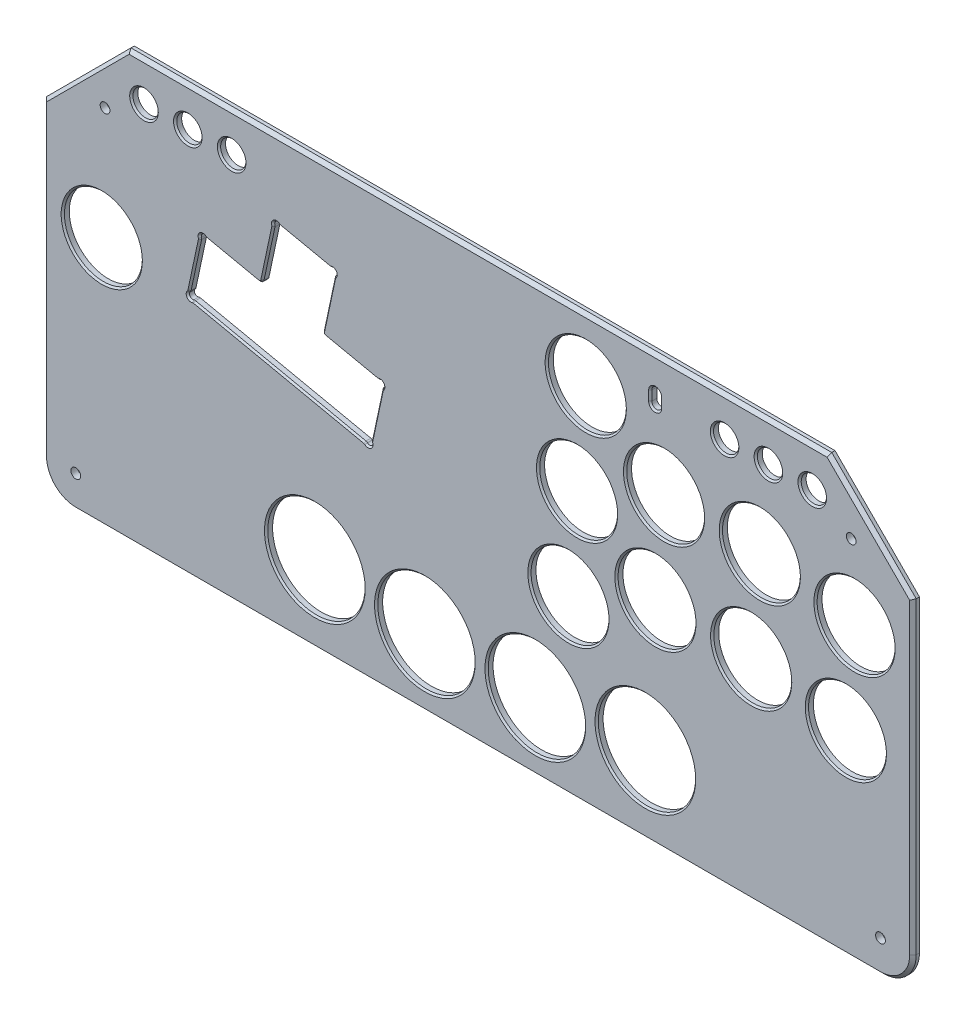
from build123d import *

# Parameters (mm, degrees)
BOSS_EXTRUDE1_DEPTH   = 2
SKETCH24_R            = 3.9
CUT_EXTRUDE2_DEPTH    = 307.159370556
SKETCH1_R             = 12
SKETCH1_R_2           = 15
CUT_EXTRUDE3_DEPTH    = 307.159370556
CUT_EXTRUDE5_DEPTH    = 326.796729683
CUT_EXTRUDE6_DEPTH    = 307.159370556
F_3_0MM_DOWEL_HOLE1_D = 3
FILLET1_R             = 1
CHAMFER1_SIZE         = 1
CHAMFER2_SIZE         = 0.5


with BuildPart() as part:
    # Sketch2 → Boss-Extrude1 (new body)
    with BuildSketch(Plane.XY):
        with BuildLine():
            Line((6.41186441, 110.238694526), (6.41186441, 15.286374556))
            ThreePointArc((6.41186441, 15.286374556), (9.340796598, 8.215306744), (16.41186441, 5.286374556))
            Line((16.41186441, 5.286374556), (264.168886442, 5.286374556))
            ThreePointArc((264.168886442, 5.286374556), (271.239954254, 8.215306744), (274.168886442, 15.286374556))
            Line((274.168886442, 15.286374556), (274.168886442, 110.238694526))
            Line((274.168886442, 110.238694526), (248.168886442, 136.238694526))
            Line((248.168886442, 136.238694526), (32.41186441, 136.238694526))
            Line((32.41186441, 136.238694526), (6.41186441, 110.238694526))
        make_face()
    extrude(amount=-BOSS_EXTRUDE1_DEPTH)

    # Sketch24 → Cut-Extrude2 (cut, through all)
    with BuildSketch(Plane.XY):
        with Locations((37.41186441, 124.238694526)):
            Circle(SKETCH24_R)
        with Locations((50.91186441, 124.238694526)):
            Circle(SKETCH24_R)
        with Locations((64.41186441, 124.238694526)):
            Circle(SKETCH24_R)
        with Locations((216.168886442, 124.238694526)):
            Circle(SKETCH24_R)
        with Locations((229.668886442, 124.238694526)):
            Circle(SKETCH24_R)
        with Locations((243.168886442, 124.238694526)):
            Circle(SKETCH24_R)
        with BuildLine():
            Line((193.298949614, 125.738694526), (193.298949614, 122.738694526))
            ThreePointArc((193.298949614, 122.738694526), (194.798949614, 121.238694526), (196.298949614, 122.738694526))
            Line((196.298949614, 122.738694526), (196.298949614, 125.738694526))
            ThreePointArc((196.298949614, 125.738694526), (194.798949614, 127.238694526), (193.298949614, 125.738694526))
        make_face()
    extrude(amount=-CUT_EXTRUDE2_DEPTH, mode=Mode.SUBTRACT)

    # Sketch1 → Cut-Extrude3 (cut, through all)
    with BuildSketch(Plane.XY):
        with Locations((24.41186441, 82.179064133)):
            Circle(SKETCH1_R)
        with Locations((168.091946024, 58.360067852)):
            Circle(SKETCH1_R)
        with Locations((194.873540874, 70.729230202)):
            Circle(SKETCH1_R)
        with Locations((224.358659158, 69.792320505)):
            Circle(SKETCH1_R)
        with Locations((253.510608286, 65.274150291)):
            Circle(SKETCH1_R)
        with Locations((256.168886442, 94.654135948)):
            Circle(SKETCH1_R)
        with Locations((227.016937315, 99.172306162)):
            Circle(SKETCH1_R)
        with Locations((197.531819031, 100.10921586)):
            Circle(SKETCH1_R)
        with Locations((170.75022418, 87.740053509)):
            Circle(SKETCH1_R)
        with Locations((191.774681199, 29.091460603)):
            Circle(SKETCH1_R_2)
        with Locations((157.891946024, 26.270067852)):
            Circle(SKETCH1_R_2)
        with Locations((123.891946024, 26.270067852)):
            Circle(SKETCH1_R_2)
        with Locations((90.009210849, 29.091460603)):
            Circle(SKETCH1_R_2)
        with Locations((173.429012786, 117.118176179)):
            Circle(SKETCH1_R)
    extrude(amount=-CUT_EXTRUDE3_DEPTH, mode=Mode.SUBTRACT)

    # Sketch4 → Cut-Extrude5 (cut, through all)
    with BuildSketch(Plane(origin=(-30.20834345, 20.07496957, 0), x_dir=(0.9781476007338056, -0.2079116908177598, 0), z_dir=(0, 0, 1))):
        Polygon((86.170570415, 113.241725336), (86.170570415, 94.191725336), (67.120570415, 94.191725336), (67.120570415, 75.141725336), (124.270570415, 75.141725336), (124.270570415, 94.191725336), (105.220570415, 94.191725336), (105.220570415, 113.241725336), align=None)
    extrude(amount=-CUT_EXTRUDE5_DEPTH, mode=Mode.SUBTRACT)

    # Sketch27 → Cut-Extrude6 (cut, through all)
    with BuildSketch(Plane.XY):
        with BuildLine():
            Line((54.735010804, 96.86991883), (56.41235194, 97.9591969))
            ThreePointArc((56.41235194, 97.9591969), (55.029042337, 98.253228433), (54.735010804, 96.86991883))
        make_face()
        with BuildLine():
            Line((51.36235616, 81.002826242), (52.45163423, 79.325485106))
            ThreePointArc((52.45163423, 79.325485106), (51.068324627, 79.619516639), (51.36235616, 81.002826242))
        make_face()
        with BuildLine():
            Line((105.586150406, 68.031395041), (107.263491542, 69.120673111))
            ThreePointArc((107.263491542, 69.120673111), (106.969460009, 67.737363508), (105.586150406, 68.031395041))
        make_face()
        with BuildLine():
            Line((109.546868116, 86.665106835), (110.636146186, 84.987765699))
            ThreePointArc((110.636146186, 84.987765699), (110.930177719, 86.371075302), (109.546868116, 86.665106835))
        make_face()
        with BuildLine():
            Line((77.329440308, 111.542912914), (79.006781444, 112.632190984))
            ThreePointArc((79.006781444, 112.632190984), (77.623471841, 112.926222516), (77.329440308, 111.542912914))
        make_face()
        with BuildLine():
            Line((94.873874032, 109.259536339), (95.963152102, 107.582195203))
            ThreePointArc((95.963152102, 107.582195203), (96.257183635, 108.965504806), (94.873874032, 109.259536339))
        make_face()
    extrude(amount=-CUT_EXTRUDE6_DEPTH, mode=Mode.SUBTRACT)

    # Ø3.0mm Dowel Hole1 (through all)
    with Locations(Plane.XY):
        with Locations((25.42227205, 117.228286886), (16.41186441, 15.286374556), (264.168886442, 15.286374556), (255.158478802, 117.228286886)):
            Hole(F_3_0MM_DOWEL_HOLE1_D / 2)

    # Fillet1
    fillet1_edges = [part.edges().sort_by_distance(p)[0] for p in [
        (105.586150406, 68.031395041, -1),
        (107.263491542, 69.120673111, -1),
        (110.636146186, 84.987765699, -1),
        (109.546868116, 86.665106835, -1),
        (92.296465925, 90.331793012, -1),
        (95.963152102, 107.582195203, -1),
        (94.873874032, 109.259536339, -1),
        (77.329440308, 111.542912914, -1),
        (79.006781444, 112.632190984, -1),
        (73.662754131, 94.292510723, -1),
        (52.45163423, 79.325485106, -1),
        (51.36235616, 81.002826242, -1),
        (54.735010804, 96.86991883, -1),
        (56.41235194, 97.9591969, -1),
    ]]
    fillet(fillet1_edges, radius=FILLET1_R)

    # Chamfer1
    chamfer1_edges = [part.edges().sort_by_distance(p)[0] for p in [
        (274.168886442, 62.762534541, 0),
        (271.239954254, 8.215306744, 0),
        (140.290375426, 5.286374556, 0),
        (9.340796598, 8.215306744, 0),
        (261.168886442, 123.238694526, 0),
        (140.290375426, 136.238694526, 0),
        (6.41186441, 62.762534541, 0),
        (19.41186441, 123.238694526, 0),
    ]]
    chamfer(chamfer1_edges, length=CHAMFER1_SIZE)

    # Chamfer2
    chamfer2_edges = [part.edges().sort_by_distance(p)[0] for p in [
        (239.268886442, 124.238694526, 0),
        (225.768886442, 124.238694526, 0),
        (212.268886442, 124.238694526, 0),
        (193.298949614, 124.238694526, 0),
        (194.798949614, 121.238694526, 0),
        (194.798949614, 127.238694526, 0),
        (196.298949614, 124.238694526, 0),
        (60.51186441, 124.238694526, 0),
        (47.01186441, 124.238694526, 0),
        (33.51186441, 124.238694526, 0),
        (161.429012786, 117.118176179, 0),
        (244.168886442, 94.654135948, 0),
        (215.016937315, 99.172306162, 0),
        (185.531819031, 100.10921586, 0),
        (158.75022418, 87.740053509, 0),
        (182.873540874, 70.729230202, 0),
        (212.358659158, 69.792320505, 0),
        (241.510608286, 65.274150291, 0),
        (176.774681199, 29.091460603, 0),
        (156.091946024, 58.360067852, 0),
        (142.891946024, 26.270067852, 0),
        (108.891946024, 26.270067852, 0),
        (75.009210849, 29.091460603, 0),
        (12.41186441, 82.179064133, 0),
        (86.940327738, 110.945863661, 0),
        (79.077438822, 112.655313348, 0),
        (94.818730018, 109.309398615, 0),
        (77.623471841, 112.926222516, 0),
        (96.257183635, 108.965504806, 0),
        (77.279578032, 111.487768899, 0),
        (95.986274466, 107.511537825, 0),
        (75.565237838, 103.242992853, 0),
        (94.198949632, 99.282275143, 0),
        (73.437157256, 94.639899446, 0),
        (92.643854649, 90.557389887, 0),
        (64.712272, 96.19499443, 0),
        (101.246948056, 88.429309305, 0),
        (56.483009318, 97.982319264, 0),
        (109.491724102, 86.714969111, 0),
        (55.029042337, 98.253228433, 0),
        (110.930177719, 86.371075302, 0),
        (54.685148528, 96.814774815, 0),
        (110.65926855, 84.917108321, 0),
        (53.048683482, 88.936372536, 0),
        (108.949818864, 77.054219405, 0),
        (51.339233796, 81.07348362, 0),
        (107.313353817, 69.175817126, 0),
        (51.068324627, 79.619516639, 0),
        (106.969460009, 67.737363508, 0),
        (52.506778244, 79.27562283, 0),
        (105.515493027, 68.008272677, 0),
        (79.018892318, 73.678440073, 0),
    ]]
    chamfer(chamfer2_edges, length=CHAMFER2_SIZE)


solid = part.part
